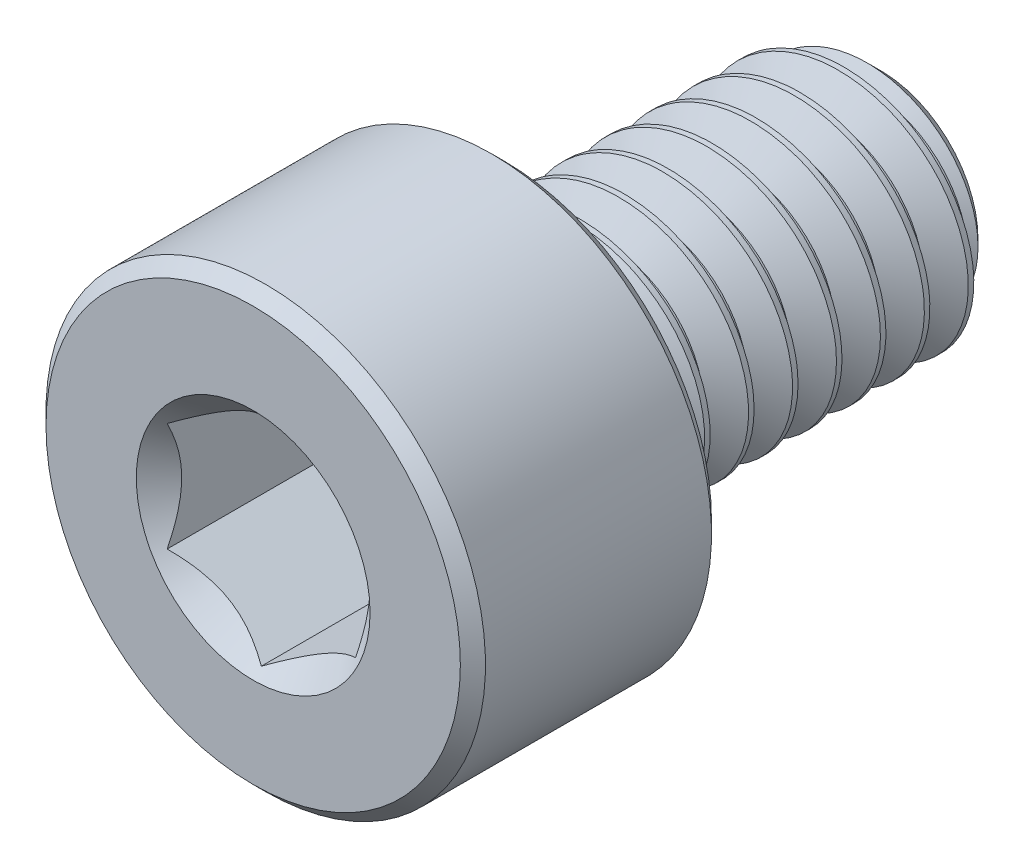
from build123d import *

# Parameters (mm, degrees)
CUT_EXTRUDE1_DEPTH     = 3
SPLIT1_SURFACE_1_BACK  = 15.071
SPLIT1_SURFACE_1_DEPTH = 30.142
SPLIT1_SURFACE_2_BACK  = 15.071
SPLIT1_SURFACE_2_DEPTH = 30.142
CUT_SWEEP1_PITCH       = 0.7


with BuildPart() as part:
    # Sketch2 → Revolve1 (revolve)
    with BuildSketch(Plane(origin=(0, 0, 0), x_dir=(0, 0, -1), z_dir=(1, 0, 0))):
        with BuildLine():
            Line((-5, 0), (-5, 3.3))
            Line((-5, 3.3), (-4.8, 3.5))
            Line((-4.8, 3.5), (-1.2, 3.5))
            Line((-1.2, 3.5), (-1, 3.3))
            Line((-1, 3.3), (-1, 2.2))
            ThreePointArc((-1, 2.2), (-0.941421356, 2.058578644), (-0.8, 2))
            Line((-0.8, 2), (4.545336663, 2))
            Line((4.545336663, 2), (5, 1.545336663))
            Line((5, 1.545336663), (5, 0))
            Line((5, 0), (-5, 0))
        make_face()
    revolve(axis=Axis((0, 0, -5), (0, 0, 1)))

    # Sketch3 → Cut-Extrude1 (cut)
    with BuildSketch(Plane.XY.offset(5)):
        Polygon((1.5, -0.866025404), (1.5, 0.866025404), (0, 1.732050808), (-1.5, 0.866025404), (-1.5, -0.866025404), (0, -1.732050808), align=None)
    extrude(amount=-CUT_EXTRUDE1_DEPTH, mode=Mode.SUBTRACT)

    # Cut-Extrude2 cone 1 section (through the dimple's axis) → Cut-Extrude2 (revolve, cut)
    with BuildSketch(Plane(origin=(0, 0, 5), x_dir=(0, -1, 0), z_dir=(1, 0, 0))):
        Polygon((0, 0), (1.861954618, 0), (0, 1.861954618), align=None)
    revolve(axis=Axis((0, 0, 5), (0, 0, -1)), mode=Mode.SUBTRACT)


with BuildPart() as body_2:
    # Split1: the piece behind the surface
    add(part.part)
    # Split1 surface: a surface, the sketch's curves swept straight by 30.142 mm
    with BuildLine(Plane(origin=(0, 0, 0), x_dir=(0, 0, -1), z_dir=(1, 0, 0)).offset(-SPLIT1_SURFACE_1_BACK), mode=Mode.PRIVATE) as split1_surface_1_path:
        Line((-0.8, -3.5), (-0.8, 3.5))
    split1_surface_1 = Shell.extrude(split1_surface_1_path.wire(), (1 * SPLIT1_SURFACE_1_DEPTH, 0 * SPLIT1_SURFACE_1_DEPTH, 0 * SPLIT1_SURFACE_1_DEPTH))
    split(bisect_by=split1_surface_1, keep=Keep.BOTTOM)

    # Cut-Sweep1: the profile of Sketch7 screwed along a right-hand helix of 9.571429 turns, 6 arcs to a turn; built about Z, then put on its axis
    cut_sweep1_z = Axis((0, 0, 0), (0, 0, 1))
    cut_sweep1_corners = [(2.037888611, 0, 0.021875), (2.037888611, 0, -0.634375), (1.545336663, 0, -0.35), (1.545336663, 0, -0.2625)]
    with BuildLine(mode=Mode.PRIVATE) as cut_sweep1_profile:
        Line(cut_sweep1_corners[0], cut_sweep1_corners[1])
        Line(cut_sweep1_corners[1], cut_sweep1_corners[2])
        Line(cut_sweep1_corners[2], cut_sweep1_corners[3])
        Line(cut_sweep1_corners[3], cut_sweep1_corners[0])
    cut_sweep1_cap = Face(cut_sweep1_profile.wire())
    cut_sweep1_turn_angles = [0, 30, 60, 90, 120, 150, 180, 210, 240, 270, 300, 330, 360]
    cut_sweep1_turn_weights = [1, 0.8660254037844387, 1, 0.8660254037844387, 1, 0.8660254037844387, 1, 0.8660254037844387, 1, 0.8660254037844387, 1, 0.8660254037844387, 1]
    cut_sweep1_turn_rails = [Edge.make_bspline([Vector(p[0], p[1], 0).rotate(cut_sweep1_z, cut_sweep1_turn_angles[k]) / cut_sweep1_turn_weights[k] + Vector(0, 0, p[2] + CUT_SWEEP1_PITCH * cut_sweep1_turn_angles[k] / 360) for k in range(13)], [0, 0, 0, 1, 1, 2, 2, 3, 3, 4, 4, 5, 5, 6, 6, 6], 2, cut_sweep1_turn_weights) for p in cut_sweep1_corners]
    cut_sweep1_turn_sides = [Face.make_surface_from_curves(cut_sweep1_turn_rails[p[0]], cut_sweep1_turn_rails[p[1]]) for p in [(0, 1), (1, 2), (2, 3), (3, 0)]]
    cut_sweep1_last_angles = [3240, 3270, 3300, 3330, 3360, 3390, 3420, 3432.857142857, 3445.714285714]
    cut_sweep1_last_weights = [1, 0.8660254037844387, 1, 0.8660254037844387, 1, 0.8660254037844387, 1, 0.9749279121818499, 1]
    cut_sweep1_last_rails = [Edge.make_bspline([Vector(p[0], p[1], 0).rotate(cut_sweep1_z, cut_sweep1_last_angles[k]) / cut_sweep1_last_weights[k] + Vector(0, 0, p[2] + CUT_SWEEP1_PITCH * cut_sweep1_last_angles[k] / 360) for k in range(9)], [0, 0, 0, 1, 1, 2, 2, 3, 3, 4, 4, 4], 2, cut_sweep1_last_weights) for p in cut_sweep1_corners]
    cut_sweep1_last_sides = [Face.make_surface_from_curves(cut_sweep1_last_rails[p[0]], cut_sweep1_last_rails[p[1]]) for p in [(0, 1), (1, 2), (2, 3), (3, 0)]]
    cut_sweep1 = Plane(origin=(0, 0, -5), x_dir=(0, 1, 0), z_dir=(0, 0, 1)) * Solid(Shell([*[p.moved(Location((0, 0, CUT_SWEEP1_PITCH * i))) for i in range(9) for p in cut_sweep1_turn_sides], *cut_sweep1_last_sides, cut_sweep1_cap, cut_sweep1_cap.rotate(cut_sweep1_z, 3445.714285714).moved(Location((0, 0, CUT_SWEEP1_PITCH * 3445.714285714 / 360)))]))
    add(cut_sweep1, mode=Mode.SUBTRACT)


with BuildPart() as part_1:
    add(part.part)

    # Split1: split by a surface, the side it looks to stays
    # Split1 surface: a surface, the sketch's curves swept straight by 30.142 mm
    with BuildLine(Plane(origin=(0, 0, 0), x_dir=(0, 0, -1), z_dir=(1, 0, 0)).offset(-SPLIT1_SURFACE_2_BACK), mode=Mode.PRIVATE) as split1_surface_2_path:
        Line((-0.8, -3.5), (-0.8, 3.5))
    split1_surface_2 = Shell.extrude(split1_surface_2_path.wire(), (1 * SPLIT1_SURFACE_2_DEPTH, 0 * SPLIT1_SURFACE_2_DEPTH, 0 * SPLIT1_SURFACE_2_DEPTH))
    split(bisect_by=split1_surface_2, keep=Keep.TOP)

    add(body_2.part)  # Revolve2 merges body 2
    # Sketch8 → Revolve2 (revolve)
    with BuildSketch(Plane(origin=(0, 0, 0), x_dir=(0, 0, -1), z_dir=(1, 0, 0)), mode=Mode.PRIVATE) as revolve2_sk:
        Polygon((-1, 0), (-1, 2), (-0.8, 2), (0.354700538, 0), align=None)
    revolve(revolve2_sk.sketch.rotate(Axis((0, 0, -0.354700538), (0, 0, 1)), 270), axis=Axis((0, 0, -0.354700538), (0, 0, 1)))


solid = part_1.part
